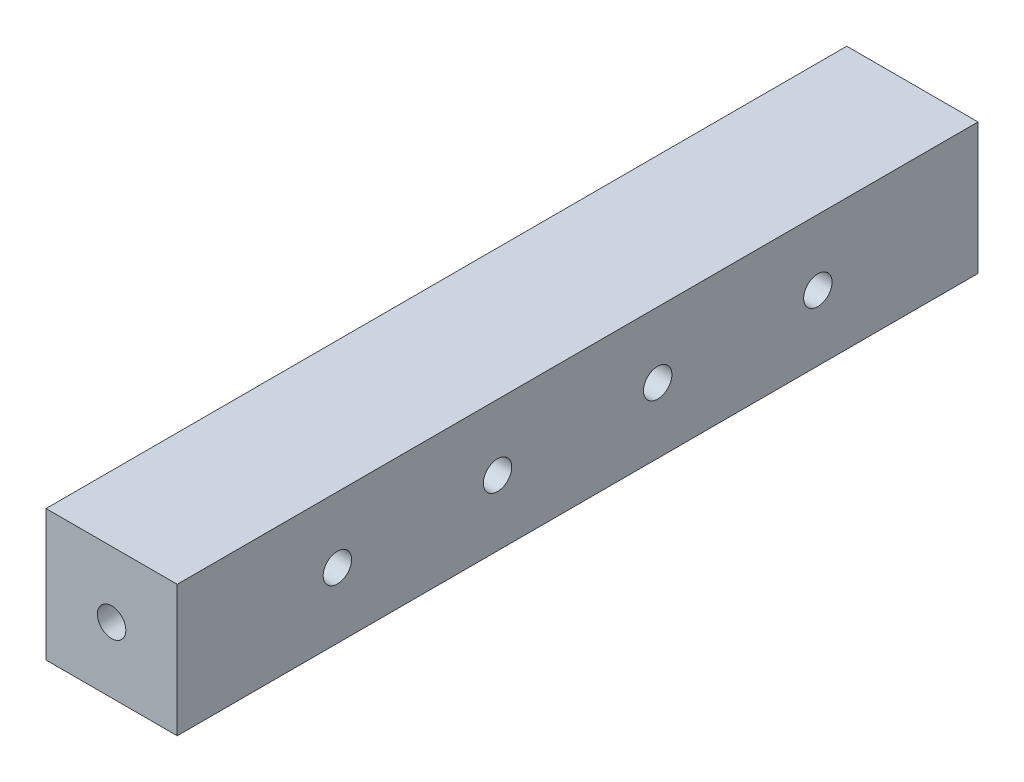
from build123d import *

# Parameters (mm, degrees)
SKETCH1_W                = 25.4
SKETCH1_H                = 25.4
BOSS_EXTRUDE1_DEPTH      = 77.5
M5_CLEARANCE_HOLE1_D     = 5.5
M5_CLEARANCE_HOLE1_DEPTH = 5.195
M5_CLEARANCE_HOLE1_TIP   = 1.652366702
M5_CLEARANCE_HOLE2_D     = 5.5
M5_CLEARANCE_HOLE2_DEPTH = 5.2
M5_CLEARANCE_HOLE2_TIP   = 1.652366702
M5_CLEARANCE_HOLE3_D     = 5.5
M5_CLEARANCE_HOLE3_DEPTH = 4.5
M5_CLEARANCE_HOLE3_TIP   = 1.652366702


with BuildPart() as part:
    # Sketch1 → Boss-Extrude1 (new, symmetric)
    with BuildSketch(Plane.XY):
        Rectangle(SKETCH1_W, SKETCH1_H)
    extrude(amount=BOSS_EXTRUDE1_DEPTH, both=True)

    # M5 Clearance Hole1
    with Locations(Plane(origin=(12.7, 0, 0), x_dir=(0, 0, -1), z_dir=(1, 0, 0))):
        with Locations((-46.5, 0), (-15.5, 0), (15.5, 0), (46.5, 0)):
            Hole(M5_CLEARANCE_HOLE1_D / 2, depth=M5_CLEARANCE_HOLE1_DEPTH)
            with Locations((0, 0, -(M5_CLEARANCE_HOLE1_DEPTH + M5_CLEARANCE_HOLE1_TIP / 2))):  # 118° drill point
                Cone(0, M5_CLEARANCE_HOLE1_D / 2, M5_CLEARANCE_HOLE1_TIP, mode=Mode.SUBTRACT)

    # M5 Clearance Hole2
    with Locations(Plane(origin=(0, -12.7, 0), x_dir=(-1, 0, 0), z_dir=(0, -1, 0))):
        with Locations((0, -62), (0, 0), (0, 62)):
            Hole(M5_CLEARANCE_HOLE2_D / 2, depth=M5_CLEARANCE_HOLE2_DEPTH)
            with Locations((0, 0, -(M5_CLEARANCE_HOLE2_DEPTH + M5_CLEARANCE_HOLE2_TIP / 2))):  # 118° drill point
                Cone(0, M5_CLEARANCE_HOLE2_D / 2, M5_CLEARANCE_HOLE2_TIP, mode=Mode.SUBTRACT)

    # M5 Clearance Hole3
    with Locations(Plane.XY.offset(77.5)):
        with Locations((0, 0)):
            Hole(M5_CLEARANCE_HOLE3_D / 2, depth=M5_CLEARANCE_HOLE3_DEPTH)
            with Locations((0, 0, -(M5_CLEARANCE_HOLE3_DEPTH + M5_CLEARANCE_HOLE3_TIP / 2))):  # 118° drill point
                Cone(0, M5_CLEARANCE_HOLE3_D / 2, M5_CLEARANCE_HOLE3_TIP, mode=Mode.SUBTRACT)


solid = part.part
